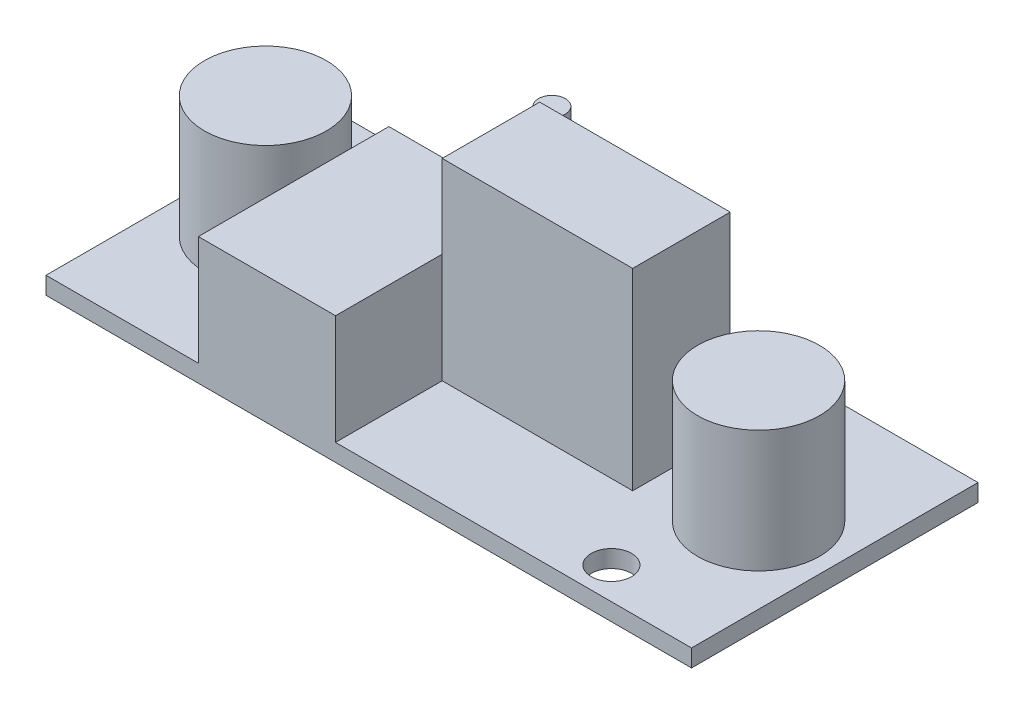
from build123d import *

# Parameters (mm, degrees)
SKETCH1_W           = 53.7972
SKETCH1_H           = 23.876
BOSS_EXTRUDE1_DEPTH = 1.4478
SKETCH2_R           = 1.68275
CUT_EXTRUDE1_DEPTH  = 30.464328446
SKETCH3_R           = 5.08
BOSS_EXTRUDE2_DEPTH = 10.16
SKETCH4_W           = 11.43
SKETCH4_H           = 15.875
BOSS_EXTRUDE3_DEPTH = 9.144
SKETCH5_W           = 9.4742
SKETCH5_H           = 4.2164
BOSS_EXTRUDE4_DEPTH = 9.144
SKETCH6_R           = 1.1176
BOSS_EXTRUDE5_DEPTH = 1.524
SKETCH7_W           = 15.875
SKETCH7_H           = 8.128
BOSS_EXTRUDE6_DEPTH = 16.0528


with BuildPart() as part:
    # Sketch1 → Boss-Extrude1 (new body)
    with BuildSketch(Plane(origin=(0, 0, 0), x_dir=(1, 0, 0), z_dir=(0, 1, 0))):
        Rectangle(SKETCH1_W, SKETCH1_H)
    extrude(amount=BOSS_EXTRUDE1_DEPTH)

    # Sketch2 → Cut-Extrude1 (cut, through all)
    with BuildSketch(Plane(origin=(0, 1.4478, 0), x_dir=(1, 0, 0), z_dir=(0, 1, 0))):
        with Locations((17.5768, -9.29005)):
            Circle(SKETCH2_R)
        with Locations((-17.5768, 9.29005)):
            Circle(SKETCH2_R)
    extrude(amount=-CUT_EXTRUDE1_DEPTH, mode=Mode.SUBTRACT)

    # Sketch3 → Boss-Extrude2 (add)
    with BuildSketch(Plane(origin=(0, 1.4478, 0), x_dir=(1, 0, 0), z_dir=(0, 1, 0))):
        with Locations((-20.5486, 0)):
            Circle(SKETCH3_R)
        with Locations((20.5486, 0)):
            Circle(SKETCH3_R)
    extrude(amount=BOSS_EXTRUDE2_DEPTH)

    # Sketch4 → Boss-Extrude3 (add)
    with BuildSketch(Plane(origin=(0, 1.4478, 0), x_dir=(1, 0, 0), z_dir=(0, 1, 0))):
        with Locations((-8.4836, -4.0005)):
            Rectangle(SKETCH4_W, SKETCH4_H)
    extrude(amount=BOSS_EXTRUDE3_DEPTH)

    # Sketch5 → Boss-Extrude4 (add)
    with BuildSketch(Plane(origin=(0, 1.4478, 0), x_dir=(1, 0, 0), z_dir=(0, 1, 0))):
        with Locations((-3.8735, 9.8298)):
            Rectangle(SKETCH5_W, SKETCH5_H)
    extrude(amount=BOSS_EXTRUDE4_DEPTH)

    # Sketch6 → Boss-Extrude5 (add)
    with BuildSketch(Plane(origin=(0, 10.5918, 0), x_dir=(1, 0, 0), z_dir=(0, 1, 0))):
        with Locations((-7.3406, 10.668)):
            Circle(SKETCH6_R)
    extrude(amount=BOSS_EXTRUDE5_DEPTH)

    # Sketch7 → Boss-Extrude6 (add)
    with BuildSketch(Plane(origin=(0, 1.4478, 0), x_dir=(1, 0, 0), z_dir=(0, 1, 0))):
        with Locations((5.1689, 1.016)):
            Rectangle(SKETCH7_W, SKETCH7_H)
    extrude(amount=BOSS_EXTRUDE6_DEPTH)


solid = part.part
